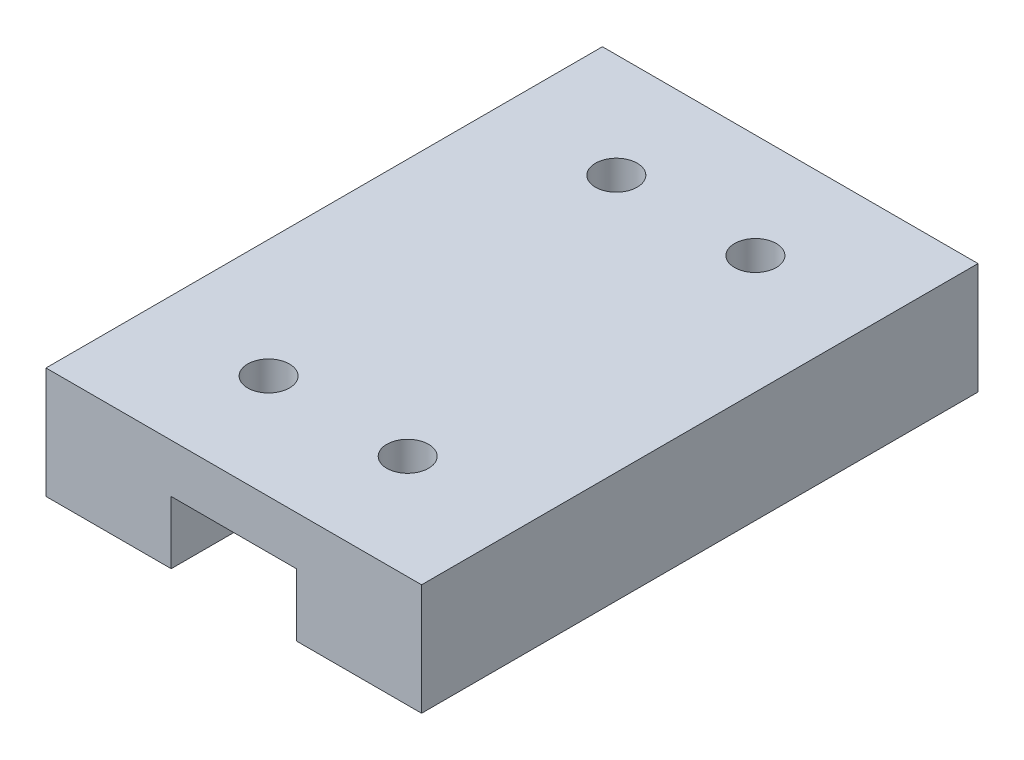
from build123d import *

# Parameters (mm, degrees)
EXTRUDE_1_DEPTH     = 20
SKETCH_2_R          = 1.5
CUT_EXTRUDE_1_DEPTH = 2.5


with BuildPart() as part:
    # 草图1 → 凸台-拉伸1 (new, symmetric)
    with BuildSketch(Plane.XY):
        Polygon((-4.5, 4.5), (4.5, 4.5), (4.5, 0), (13.5, 0), (13.5, 8), (-13.5, 8), (-13.5, 0), (-4.5, 0), align=None)
    extrude(amount=EXTRUDE_1_DEPTH, both=True)

    # 草图2 → 切除-拉伸1 (cut)
    with BuildSketch(Plane(origin=(0, 8, 0), x_dir=(1, 0, 0), z_dir=(0, 1, 0))):
        with Locations((5, 12.5)):
            Circle(SKETCH_2_R)
        with Locations((-5, 12.5)):
            Circle(SKETCH_2_R)
        with Locations((-5, -12.5)):
            Circle(SKETCH_2_R)
        with Locations((5, -12.5)):
            Circle(SKETCH_2_R)
    extrude(amount=-CUT_EXTRUDE_1_DEPTH, mode=Mode.SUBTRACT)


solid = part.part
